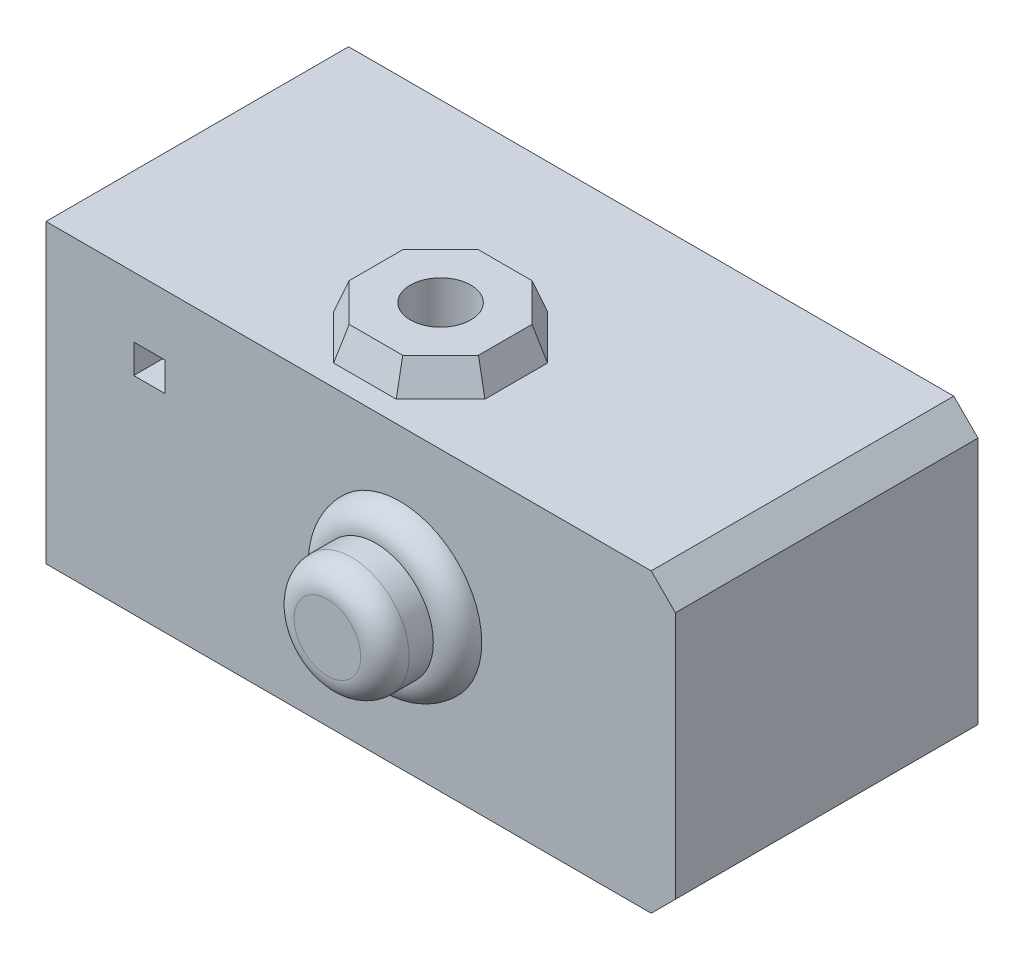
from build123d import *

# Parameters (mm, degrees)
SKETCH1_W              = 53
SKETCH1_H              = 24.5
BOSS_EXTRUDE1_DEPTH    = 25
BOSS_EXTRUDE2_DEPTH    = 2.5
BOSS_EXTRUDE2_TAPER    = 20
SKETCH3_R              = 2.5
CUT_EXTRUDE1_DEPTH     = 65.521314308
SKETCH4_W              = 3.66
SKETCH4_H              = 9
CUT_EXTRUDE2_DEPTH     = 5
SKETCH5_W              = 0.5
SKETCH5_H              = 0.5
BOSS_EXTRUDE3_DEPTH    = 5
FILLET1_R              = 0.1
LPATTERN1_COUNT        = 4
LPATTERN1_PITCH        = 2
FILLET1_OF_LPATTERN1_R = 0.1
SKETCH6_R              = 1.25
CUT_EXTRUDE3_DEPTH     = 5
SKETCH7_W              = 2.6
SKETCH7_H              = 2.4
CUT_EXTRUDE4_DEPTH     = 2.5
SKETCH8_R              = 6.75
BOSS_EXTRUDE4_DEPTH    = 2
FILLET2_R              = 2
SKETCH9_R              = 4.75
BOSS_EXTRUDE5_DEPTH    = 4
FILLET3_R              = 2
CHAMFER1_SIZE          = 1
CHAMFER2_SIZE          = 2


with BuildPart() as part:
    # Sketch1 → Boss-Extrude1 (new body)
    with BuildSketch(Plane.XY):
        with Locations((26.5, 12.25)):
            Rectangle(SKETCH1_W, SKETCH1_H)
    extrude(amount=BOSS_EXTRUDE1_DEPTH)

    # Sketch2 → Boss-Extrude2 (add)
    with BuildSketch(Plane(origin=(0, 24.5, 0), x_dir=(1, 0, 0), z_dir=(0, 1, 0))):
        Polygon((31.85, -19.588834765), (31.85, -14.411165235), (28.188834765, -10.75), (23.011165235, -10.75), (19.35, -14.411165235), (19.35, -19.588834765), (23.011165235, -23.25), (28.188834765, -23.25), align=None)
    extrude(amount=BOSS_EXTRUDE2_DEPTH, taper=BOSS_EXTRUDE2_TAPER)

    # Sketch3 → Cut-Extrude1 (cut, through all)
    with BuildSketch(Plane(origin=(0, 27, 0), x_dir=(1, 0, 0), z_dir=(0, 1, 0))):
        with Locations(Location((25.6, -17, 0), (0, 0, 270))):
            Circle(SKETCH3_R)
    extrude(amount=-CUT_EXTRUDE1_DEPTH, mode=Mode.SUBTRACT)

    # Sketch4 → Cut-Extrude2 (cut)
    with BuildSketch(Plane.ZY):
        with Locations((15.03, 12)):
            Rectangle(SKETCH4_W, SKETCH4_H)
    extrude(amount=-CUT_EXTRUDE2_DEPTH, mode=Mode.SUBTRACT)

    # Sketch5 → Boss-Extrude3 (add)
    with BuildSketch(Plane.ZY.offset(-5)):
        with Locations((15.5, 15)):
            Rectangle(SKETCH5_W, SKETCH5_H)
    boss_extrude3 = extrude(amount=BOSS_EXTRUDE3_DEPTH)

    # Fillet1
    fillet1_edges = [part.edges().sort_by_distance(p)[0] for p in [
        (5, 15, 15.25),
        (2.5, 15.25, 15.25),
        (5, 14.75, 15.5),
        (2.5, 14.75, 15.25),
        (5, 15, 15.75),
        (2.5, 14.75, 15.75),
        (5, 15.25, 15.5),
        (2.5, 15.25, 15.75),
        (0, 15, 15.25),
        (0, 14.75, 15.5),
        (0, 15, 15.75),
        (0, 15.25, 15.5),
    ]]
    fillet(fillet1_edges, radius=FILLET1_R)

    # LPattern1: Boss-Extrude3 ×4
    with Locations(*[(0, -i * LPATTERN1_PITCH, 0) for i in range(1, LPATTERN1_COUNT)]):
        add(boss_extrude3)

    # Fillet1 of LPattern1
    fillet1_of_lpattern1_edges = [part.edges().sort_by_distance(p)[0] for p in [
        (5, 13, 15.25),
        (2.5, 13.25, 15.25),
        (5, 12.75, 15.5),
        (2.5, 12.75, 15.25),
        (5, 13, 15.75),
        (2.5, 12.75, 15.75),
        (5, 13.25, 15.5),
        (2.5, 13.25, 15.75),
        (0, 13, 15.25),
        (0, 12.75, 15.5),
        (0, 13, 15.75),
        (0, 13.25, 15.5),
        (5, 11, 15.25),
        (2.5, 11.25, 15.25),
        (5, 10.75, 15.5),
        (2.5, 10.75, 15.25),
        (5, 11, 15.75),
        (2.5, 10.75, 15.75),
        (5, 11.25, 15.5),
        (2.5, 11.25, 15.75),
        (0, 11, 15.25),
        (0, 10.75, 15.5),
        (0, 11, 15.75),
        (0, 11.25, 15.5),
        (5, 9, 15.25),
        (2.5, 9.25, 15.25),
        (5, 8.75, 15.5),
        (2.5, 8.75, 15.25),
        (5, 9, 15.75),
        (2.5, 8.75, 15.75),
        (5, 9.25, 15.5),
        (2.5, 9.25, 15.75),
        (0, 9, 15.25),
        (0, 8.75, 15.5),
        (0, 9, 15.75),
        (0, 9.25, 15.5),
    ]]
    fillet(fillet1_of_lpattern1_edges, radius=FILLET1_OF_LPATTERN1_R)

    # Sketch6 → Cut-Extrude3 (cut)
    with BuildSketch(Plane(origin=(0, 0, 0), x_dir=(-1, 0, 0), z_dir=(0, 0, -1))):
        with Locations((-39, 19)):
            Circle(SKETCH6_R)
        with Locations((-39, 6.5)):
            Circle(SKETCH6_R)
        with Locations((-14, 19)):
            Circle(SKETCH6_R)
    extrude(amount=-CUT_EXTRUDE3_DEPTH, mode=Mode.SUBTRACT)

    # Sketch7 → Cut-Extrude4 (cut)
    with BuildSketch(Plane.XY.offset(25)):
        with Locations((9.55, 18.3)):
            Rectangle(SKETCH7_W, SKETCH7_H)
    extrude(amount=-CUT_EXTRUDE4_DEPTH, mode=Mode.SUBTRACT)

    # Sketch8 → Boss-Extrude4 (add)
    with BuildSketch(Plane.XY.offset(25)):
        with Locations(Location((30.25, 12.35, 0), (0, 0, 180))):
            Circle(SKETCH8_R)
    extrude(amount=BOSS_EXTRUDE4_DEPTH)

    # Fillet2
    fillet2_edges = [part.edges().sort_by_distance(p)[0] for p in [
        (37, 12.35, 27),
    ]]
    fillet(fillet2_edges, radius=FILLET2_R - 0.0001)  # a hair under: the kernel refuses the full size

    # Sketch9 → Boss-Extrude5 (add)
    with BuildSketch(Plane.XY.offset(27)):
        with Locations((30.25, 12.35)):
            Circle(SKETCH9_R)
    extrude(amount=BOSS_EXTRUDE5_DEPTH)

    # Fillet3
    fillet3_edges = [part.edges().sort_by_distance(p)[0] for p in [
        (25.5, 12.35, 31),
    ]]
    fillet(fillet3_edges, radius=FILLET3_R)

    # Chamfer1
    chamfer1_edges = [part.edges().sort_by_distance(p)[0] for p in [
        (0, 12.25, 25),
        (0, 24.5, 12.5),
        (0, 0, 12.5),
    ]]
    chamfer(chamfer1_edges, length=CHAMFER1_SIZE)

    # Chamfer2
    chamfer2_edges = [part.edges().sort_by_distance(p)[0] for p in [
        (53, 24.5, 12.5),
        (53, 0, 12.5),
    ]]
    chamfer(chamfer2_edges, length=CHAMFER2_SIZE)


solid = part.part
